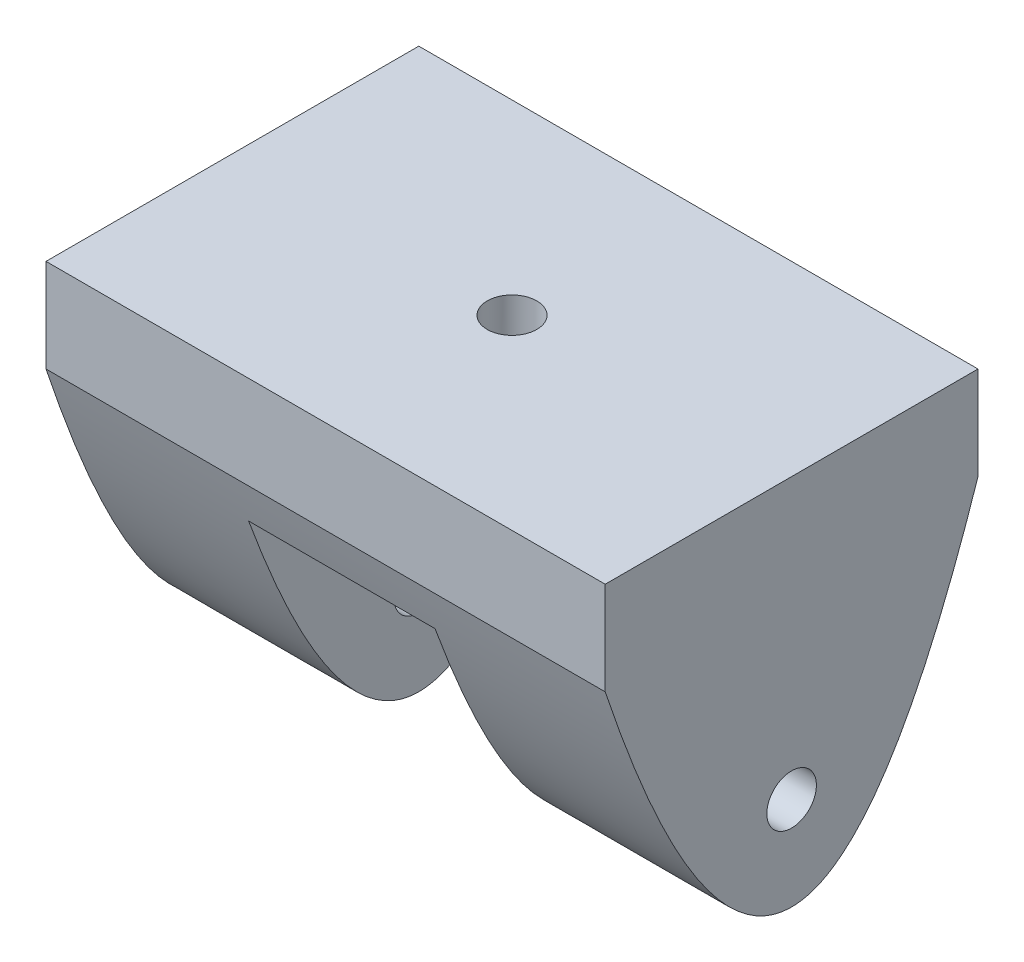
from build123d import *

# Parameters (mm, degrees)
SKETCH1_W           = 76.2
SKETCH1_H           = 50.8
BOSS_EXTRUDE1_DEPTH = 19.05
SKETCH1_7_W         = 25.4
SKETCH1_7_H         = 50.8
BOSS_EXTRUDE3_DEPTH = 44.45
SKETCH2_R           = 3.3782
CUT_EXTRUDE4_DEPTH  = 92.800885072
SKETCH3_R           = 3.3782
CUT_EXTRUDE5_DEPTH  = 69.391593218
CUT_EXTRUDE6_DEPTH  = 4.445


with BuildPart() as part:
    # Sketch1 → Boss-Extrude1 (new body)
    with BuildSketch(Plane(origin=(0, 0, 0), x_dir=(1, 0, 0), z_dir=(0, 1, 0))):
        Rectangle(SKETCH1_W, SKETCH1_H)
    extrude(amount=BOSS_EXTRUDE1_DEPTH)

    # Sketch1<7> → Boss-Extrude3 (add)
    with BuildSketch(Plane(origin=(0, 0, 0), x_dir=(1, 0, 0), z_dir=(0, 1, 0))):
        with Locations((-25.4, 0)):
            Rectangle(SKETCH1_7_W, SKETCH1_7_H)
        with Locations((25.4, 0)):
            Rectangle(SKETCH1_7_W, SKETCH1_7_H)
    extrude(amount=-BOSS_EXTRUDE3_DEPTH)

    # Sketch2 → Cut-Extrude4 (cut, through all)
    with BuildSketch(Plane.ZY.offset(38.1)):
        with Locations((0, -19.05)):
            Circle(SKETCH2_R)
        with BuildLine():
            add(Edge.make_bspline(
                [(25.4, 6.35), (0, -69.85), (-25.4, 6.35)],
                knots=[0, 0, 0, 1, 1, 1], degree=2))
            Line((-25.4, 6.35), (-25.4, -44.45))
            Line((-25.4, -44.45), (25.4, -44.45))
            Line((25.4, -44.45), (25.4, 6.35))
        make_face()
    extrude(amount=-CUT_EXTRUDE4_DEPTH, mode=Mode.SUBTRACT)

    # Sketch3 → Cut-Extrude5 (cut, through all)
    with BuildSketch(Plane(origin=(0, 19.05, 0), x_dir=(1, 0, 0), z_dir=(0, 1, 0))):
        Circle(SKETCH3_R)
    extrude(amount=-CUT_EXTRUDE5_DEPTH, mode=Mode.SUBTRACT)

    # Sketch4 → Cut-Extrude6 (cut, symmetric)
    with BuildSketch(Plane(origin=(0, 9.525, 0), x_dir=(-1, 0, 0), z_dir=(0, -1, 0))):
        Polygon((-3.299556788, -5.715), (3.299556788, -5.715), (6.599113577, 0), (6.599113577, 25.4), (-6.599113577, 25.4), (-6.599113577, 0), align=None)
    extrude(amount=CUT_EXTRUDE6_DEPTH, both=True, mode=Mode.SUBTRACT)


solid = part.part
